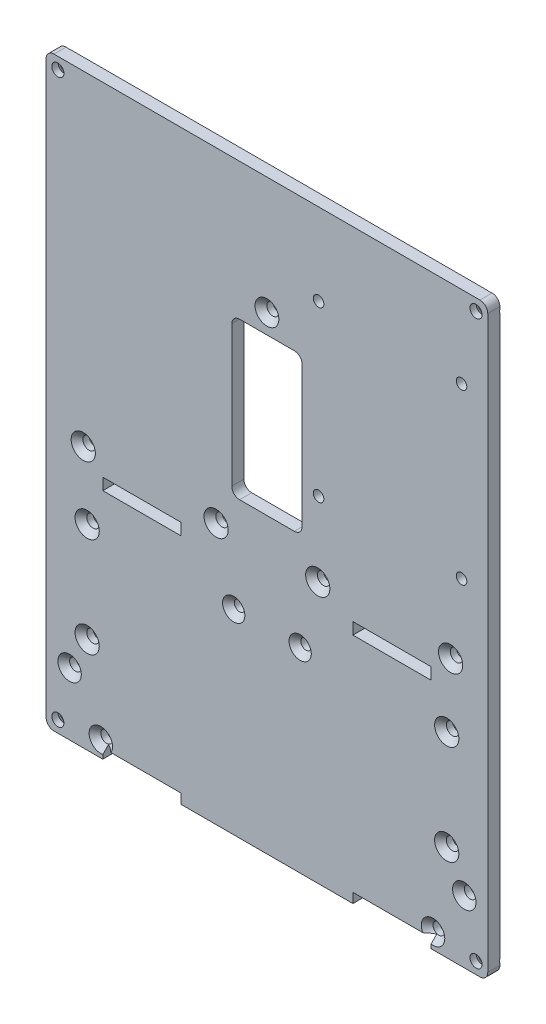
from build123d import *

# Parameters (mm, degrees)
SKETCH1_W           = 113
SKETCH1_H           = 150
BOSS_EXTRUDE1_DEPTH = 3.1
SKETCH3_R           = 1.6
CUT_EXTRUDE1_DEPTH  = 28
SKETCH7_W           = 20
SKETCH7_H           = 3
CUT_EXTRUDE5_DEPTH  = 94.9513704
SKETCH8_R           = 1.55
CUT_EXTRUDE6_DEPTH  = 94.9513704
SKETCH9_R           = 1.55
CUT_EXTRUDE7_DEPTH  = 94.9513704
SKETCH10_W          = 18
SKETCH10_H          = 40
CUT_EXTRUDE8_DEPTH  = 94.9513704
FILLET1_R           = 2
SKETCH11_R          = 1.35
CUT_EXTRUDE9_DEPTH  = 94.9513704
SKETCH12_R          = 1.35
CYTRON_DEPTH        = 94.9513704
SKETCH14_R          = 1.5
GUIDEMOUNT_DEPTH    = 94.9513704
CHAMFER1_SIZE       = 1.5
FILLET2_R           = 2


with BuildPart() as part:
    # Sketch1 → Boss-Extrude1 (new body)
    with BuildSketch(Plane.XY):
        Rectangle(SKETCH1_W, SKETCH1_H)
    extrude(amount=BOSS_EXTRUDE1_DEPTH)

    # Sketch3 → Cut-Extrude1 (cut)
    with BuildSketch(Plane.XY.offset(3.1)):
        with Locations((-47, -8.2)):
            Circle(SKETCH3_R)
        with Locations((-13, -8.2)):
            Circle(SKETCH3_R)
        with Locations((-46, -24.95)):
            Circle(SKETCH3_R)
        with Locations((-46, -50.45)):
            Circle(SKETCH3_R)
    cut_extrude1 = extrude(amount=-CUT_EXTRUDE1_DEPTH, mode=Mode.SUBTRACT)

    # Mirror1: Cut-Extrude1 across plane
    add(cut_extrude1.mirror(Plane(origin=(0, 0, 0), x_dir=(0, 0, 1), z_dir=(1, 0, 0))), mode=Mode.SUBTRACT)

    # Sketch7 → Cut-Extrude5 (cut, through all)
    with BuildSketch(Plane.XY.offset(3.1)):
        with Locations((-32, -14)):
            Rectangle(SKETCH7_W, SKETCH7_H)
        with Locations((-32, -74)):
            Rectangle(SKETCH7_W, SKETCH7_H)
        with Locations((32, -74)):
            Rectangle(SKETCH7_W, SKETCH7_H)
        with Locations((32, -14)):
            Rectangle(SKETCH7_W, SKETCH7_H)
    extrude(amount=-CUT_EXTRUDE5_DEPTH, mode=Mode.SUBTRACT)

    # Sketch8 → Cut-Extrude6 (cut, through all)
    with BuildSketch(Plane.XY.offset(3.1)):
        with Locations((0, 45)):
            Circle(SKETCH8_R)
    extrude(amount=-CUT_EXTRUDE6_DEPTH, mode=Mode.SUBTRACT)

    # Sketch9 → Cut-Extrude7 (cut, through all)
    with BuildSketch(Plane.XY.offset(3.1)):
        with Locations((-53.5, 72)):
            Circle(SKETCH9_R)
        with Locations((53.5, 72)):
            Circle(SKETCH9_R)
        with Locations((53.5, -72)):
            Circle(SKETCH9_R)
        with Locations((-53.5, -72)):
            Circle(SKETCH9_R)
    extrude(amount=-CUT_EXTRUDE7_DEPTH, mode=Mode.SUBTRACT)

    # Sketch10 → Cut-Extrude8 (cut, through all)
    with BuildSketch(Plane.XY.offset(3.1)):
        with Locations((0, 20)):
            Rectangle(SKETCH10_W, SKETCH10_H)
    extrude(amount=-CUT_EXTRUDE8_DEPTH, mode=Mode.SUBTRACT)

    # Fillet1
    fillet1_edges = [part.edges().sort_by_distance(p)[0] for p in [
        (-9, 40, 1.55),
        (9, 40, 1.55),
        (9, 0, 1.55),
        (-9, 0, 1.55),
    ]]
    fillet(fillet1_edges, radius=FILLET1_R)

    # Sketch11 → Cut-Extrude9 (cut, through all)
    with BuildSketch(Plane.XY.offset(3.1)):
        with Locations((-8.5, -25)):
            Circle(SKETCH11_R)
        with Locations((8.5, -25)):
            Circle(SKETCH11_R)
    extrude(amount=-CUT_EXTRUDE9_DEPTH, mode=Mode.SUBTRACT)

    # Sketch12 → Cytron (cut, through all)
    with BuildSketch(Plane.XY.offset(3.1)):
        with Locations((13.21, 54.09)):
            Circle(SKETCH12_R)
        with Locations((49.79, 54.09)):
            Circle(SKETCH12_R)
        with Locations((49.79, 10.91)):
            Circle(SKETCH12_R)
        with Locations((13.21, 10.91)):
            Circle(SKETCH12_R)
    extrude(amount=-CYTRON_DEPTH, mode=Mode.SUBTRACT)

    # Sketch14 → GuideMount (cut, through all)
    with BuildSketch(Plane.XY.offset(3.1)):
        with Locations((-42.5, -71)):
            Circle(SKETCH14_R)
        with Locations((-50.5, -59)):
            Circle(SKETCH14_R)
    guidemount = extrude(amount=-GUIDEMOUNT_DEPTH, mode=Mode.SUBTRACT)

    # Mirror2: GuideMount across plane
    add(guidemount.mirror(Plane(origin=(0, 0, 0), x_dir=(0, 0, 1), z_dir=(1, 0, 0))), mode=Mode.SUBTRACT)

    # Chamfer1
    # the kernel refuses this chamfer: 1.5 mm, written as the material it takes off along each edge
    with BuildSketch(Plane(origin=(0, 45, 3.1), x_dir=(1, 0, 0), z_dir=(0, -1, 0))) as chamfer1_piece_1:
        Polygon((1.55, -CHAMFER1_SIZE), (1.55 + CHAMFER1_SIZE, 0), (1.55, 0), align=None)
    revolve(axis=Axis((0, 45, 3.1), (0, 0, 1)), mode=Mode.SUBTRACT)
    with BuildSketch(Plane(origin=(-53.5, -72, 0), x_dir=(1, 0, 0), z_dir=(0, -1, 0))) as chamfer1_piece_2:
        Polygon((1.55 + CHAMFER1_SIZE, 0), (1.55, CHAMFER1_SIZE), (1.55, 0), align=None)
    revolve(axis=Axis((-53.5, -72, 0), (0, 0, 1)), mode=Mode.SUBTRACT)
    with BuildSketch(Plane(origin=(53.5, -72, 0), x_dir=(1, 0, 0), z_dir=(0, -1, 0))) as chamfer1_piece_3:
        Polygon((1.55 + CHAMFER1_SIZE, 0), (1.55, CHAMFER1_SIZE), (1.55, 0), align=None)
    revolve(axis=Axis((53.5, -72, 0), (0, 0, 1)), mode=Mode.SUBTRACT)
    with BuildSketch(Plane(origin=(53.5, 72, 0), x_dir=(1, 0, 0), z_dir=(0, -1, 0))) as chamfer1_piece_4:
        Polygon((1.55 + CHAMFER1_SIZE, 0), (1.55, CHAMFER1_SIZE), (1.55, 0), align=None)
    revolve(axis=Axis((53.5, 72, 0), (0, 0, 1)), mode=Mode.SUBTRACT)
    with BuildSketch(Plane(origin=(-53.5, 72, 0), x_dir=(1, 0, 0), z_dir=(0, -1, 0))) as chamfer1_piece_5:
        Polygon((1.55 + CHAMFER1_SIZE, 0), (1.55, CHAMFER1_SIZE), (1.55, 0), align=None)
    revolve(axis=Axis((-53.5, 72, 0), (0, 0, 1)), mode=Mode.SUBTRACT)
    with BuildSketch(Plane(origin=(-13, -8.2, 3.1), x_dir=(1, 0, 0), z_dir=(0, -1, 0))) as chamfer1_piece_6:
        Polygon((1.6, -CHAMFER1_SIZE), (1.6 + CHAMFER1_SIZE, 0), (1.6, 0), align=None)
    revolve(axis=Axis((-13, -8.2, 3.1), (0, 0, 1)), mode=Mode.SUBTRACT)
    with BuildSketch(Plane(origin=(8.5, -25, 3.1), x_dir=(1, 0, 0), z_dir=(0, -1, 0))) as chamfer1_piece_7:
        Polygon((1.35, -CHAMFER1_SIZE), (1.35 + CHAMFER1_SIZE, 0), (1.35, 0), align=None)
    revolve(axis=Axis((8.5, -25, 3.1), (0, 0, 1)), mode=Mode.SUBTRACT)
    with BuildSketch(Plane(origin=(-8.5, -25, 3.1), x_dir=(1, 0, 0), z_dir=(0, -1, 0))) as chamfer1_piece_8:
        Polygon((1.35, -CHAMFER1_SIZE), (1.35 + CHAMFER1_SIZE, 0), (1.35, 0), align=None)
    revolve(axis=Axis((-8.5, -25, 3.1), (0, 0, 1)), mode=Mode.SUBTRACT)
    with BuildSketch(Plane(origin=(-47, -8.2, 3.1), x_dir=(1, 0, 0), z_dir=(0, -1, 0))) as chamfer1_piece_9:
        Polygon((1.6, -CHAMFER1_SIZE), (1.6 + CHAMFER1_SIZE, 0), (1.6, 0), align=None)
    revolve(axis=Axis((-47, -8.2, 3.1), (0, 0, 1)), mode=Mode.SUBTRACT)
    with BuildSketch(Plane(origin=(-42.5, -71, 3.1), x_dir=(1, 0, 0), z_dir=(0, -1, 0))) as chamfer1_piece_10:
        Polygon((1.5, -CHAMFER1_SIZE), (1.5 + CHAMFER1_SIZE, 0), (1.5, 0), align=None)
    revolve(axis=Axis((-42.5, -71, 3.1), (0, 0, 1)), mode=Mode.SUBTRACT)
    with BuildSketch(Plane(origin=(-50.5, -59, 3.1), x_dir=(1, 0, 0), z_dir=(0, -1, 0))) as chamfer1_piece_11:
        Polygon((1.5, -CHAMFER1_SIZE), (1.5 + CHAMFER1_SIZE, 0), (1.5, 0), align=None)
    revolve(axis=Axis((-50.5, -59, 3.1), (0, 0, 1)), mode=Mode.SUBTRACT)
    with BuildSketch(Plane(origin=(-46, -24.95, 3.1), x_dir=(1, 0, 0), z_dir=(0, -1, 0))) as chamfer1_piece_12:
        Polygon((1.6, -CHAMFER1_SIZE), (1.6 + CHAMFER1_SIZE, 0), (1.6, 0), align=None)
    revolve(axis=Axis((-46, -24.95, 3.1), (0, 0, 1)), mode=Mode.SUBTRACT)
    with BuildSketch(Plane(origin=(42.5, -71, 3.1), x_dir=(-1, 0, 0), z_dir=(0, -1, 0))) as chamfer1_piece_13:
        Polygon((1.5, CHAMFER1_SIZE), (1.5 + CHAMFER1_SIZE, 0), (1.5, 0), align=None)
    revolve(axis=Axis((42.5, -71, 3.1), (0, 0, -1)), mode=Mode.SUBTRACT)
    with BuildSketch(Plane(origin=(50.5, -59, 3.1), x_dir=(-1, 0, 0), z_dir=(0, -1, 0))) as chamfer1_piece_14:
        Polygon((1.5, CHAMFER1_SIZE), (1.5 + CHAMFER1_SIZE, 0), (1.5, 0), align=None)
    revolve(axis=Axis((50.5, -59, 3.1), (0, 0, -1)), mode=Mode.SUBTRACT)
    with BuildSketch(Plane(origin=(-46, -50.45, 3.1), x_dir=(1, 0, 0), z_dir=(0, -1, 0))) as chamfer1_piece_15:
        Polygon((1.6, -CHAMFER1_SIZE), (1.6 + CHAMFER1_SIZE, 0), (1.6, 0), align=None)
    revolve(axis=Axis((-46, -50.45, 3.1), (0, 0, 1)), mode=Mode.SUBTRACT)
    with BuildSketch(Plane(origin=(13, -8.2, 3.1), x_dir=(-1, 0, 0), z_dir=(0, -1, 0))) as chamfer1_piece_16:
        Polygon((1.6, CHAMFER1_SIZE), (1.6 + CHAMFER1_SIZE, 0), (1.6, 0), align=None)
    revolve(axis=Axis((13, -8.2, 3.1), (0, 0, -1)), mode=Mode.SUBTRACT)
    with BuildSketch(Plane(origin=(47, -8.2, 3.1), x_dir=(-1, 0, 0), z_dir=(0, -1, 0))) as chamfer1_piece_17:
        Polygon((1.6, CHAMFER1_SIZE), (1.6 + CHAMFER1_SIZE, 0), (1.6, 0), align=None)
    revolve(axis=Axis((47, -8.2, 3.1), (0, 0, -1)), mode=Mode.SUBTRACT)
    with BuildSketch(Plane(origin=(46, -24.95, 3.1), x_dir=(-1, 0, 0), z_dir=(0, -1, 0))) as chamfer1_piece_18:
        Polygon((1.6, CHAMFER1_SIZE), (1.6 + CHAMFER1_SIZE, 0), (1.6, 0), align=None)
    revolve(axis=Axis((46, -24.95, 3.1), (0, 0, -1)), mode=Mode.SUBTRACT)
    with BuildSketch(Plane(origin=(46, -50.45, 3.1), x_dir=(-1, 0, 0), z_dir=(0, -1, 0))) as chamfer1_piece_19:
        Polygon((1.6, CHAMFER1_SIZE), (1.6 + CHAMFER1_SIZE, 0), (1.6, 0), align=None)
    revolve(axis=Axis((46, -50.45, 3.1), (0, 0, -1)), mode=Mode.SUBTRACT)

    # Fillet2
    fillet2_edges = [part.edges().sort_by_distance(p)[0] for p in [
        (-56.5, 75, 1.55),
        (56.5, 75, 1.55),
        (56.5, -75, 1.55),
        (-56.5, -75, 1.55),
    ]]
    fillet(fillet2_edges, radius=FILLET2_R)


solid = part.part
